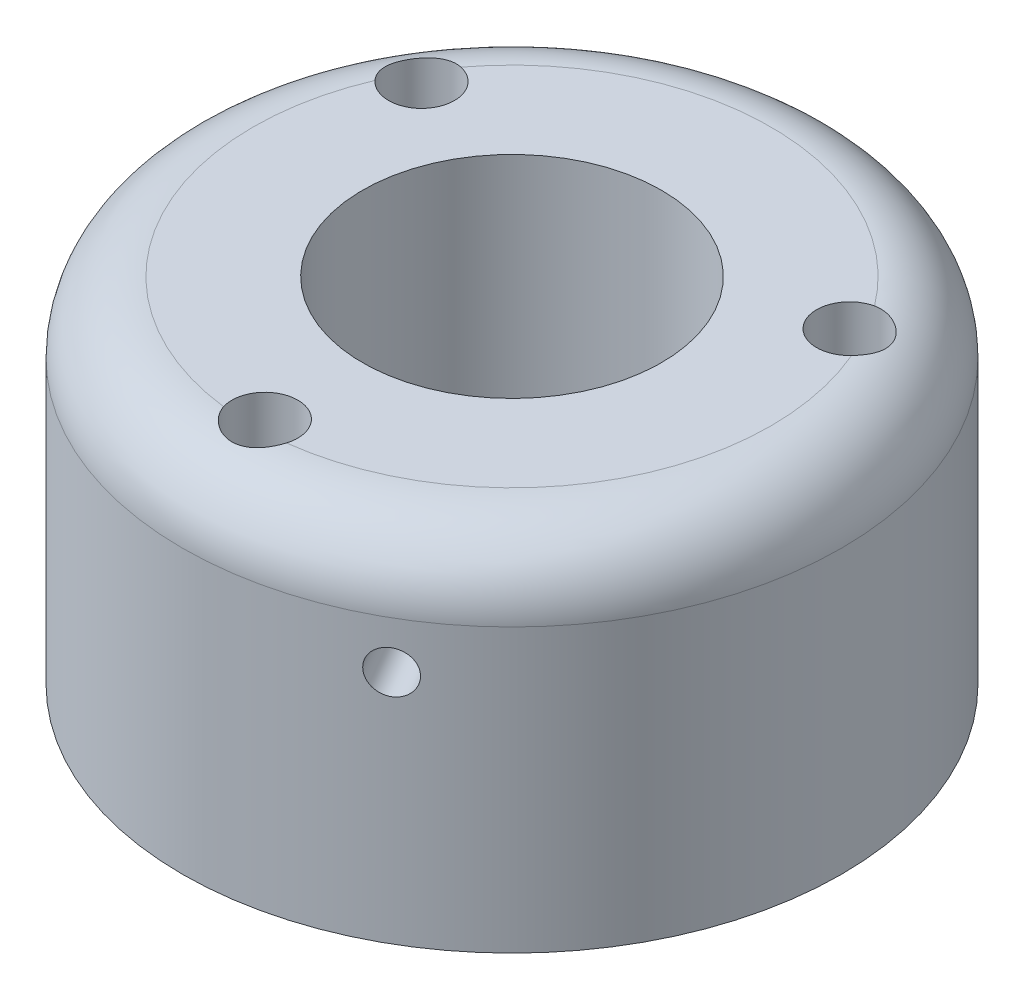
from build123d import *

# Parameters (mm, degrees)
SKETCH1_R               = 14
BOSS_EXTRUDE1_DEPTH     = 15
SKETCH2_R               = 1.4
SKETCH2_R_2             = 6.35
CUT_EXTRUDE1_DEPTH      = 25.839484697
BOSS_EXTRUDE2_DEPTH     = 2
CUT_EXTRUDE2_DEPTH      = 17
CUT_EXTRUDE2_DEPTH_BACK = 10
SKETCH4_R               = 0.9
SKETCH4_W               = 10.5
SKETCH4_H               = 2
SKETCH5_R               = 2.8
CUT_EXTRUDE3_DEPTH      = 5
FILLET1_R               = 3


with BuildPart() as part:
    # Sketch1 → Boss-Extrude1 (new body)
    with BuildSketch(Plane(origin=(0, 0, 0), x_dir=(1, 0, 0), z_dir=(0, 1, 0))):
        with Locations(Location((0, 0, 0), (0, 0, 270))):
            Circle(SKETCH1_R)
    extrude(amount=BOSS_EXTRUDE1_DEPTH)

    # Sketch2 → Cut-Extrude1 (cut, through all)
    with BuildSketch(Plane.XZ):
        with Locations(Location((0, 10.5, 0), (0, 0, 270))):
            Circle(SKETCH2_R)
        with Locations(Location((0, 0, 0), (0, 0, 270))):
            Circle(SKETCH2_R_2)
        with Locations(Location((9.09326674, -5.25, 0), (0, 0, 270))):
            Circle(SKETCH2_R)
        with Locations(Location((-9.09326674, -5.25, 0), (0, 0, 270))):
            Circle(SKETCH2_R)
    extrude(amount=-CUT_EXTRUDE1_DEPTH, mode=Mode.SUBTRACT)

    # Sketch3 → Boss-Extrude2 (add)
    with BuildSketch(Plane(origin=(0, 0, 0), x_dir=(1, 0, 0), z_dir=(0, 1, 0))):
        Polygon((0, 0), (9.09326674, -5.25), (0, -10.5), align=None)
    extrude(amount=-BOSS_EXTRUDE2_DEPTH)

    # Sketch4 → Cut-Extrude2 (cut, two sides: drawn at the far end of the back side and taken through both)
    with BuildSketch(Plane(origin=(4.54663337, 0, 7.875), x_dir=(0.8660254037844364, 0, -0.5000000000000041), z_dir=(0.500000000000004, 0, 0.8660254037844363)).offset(-CUT_EXTRUDE2_DEPTH_BACK)):
        with Locations(Location((0, 10, 0), (0, 0, 180))):
            Circle(SKETCH4_R)
        with Locations((0, -1)):
            Rectangle(SKETCH4_W, SKETCH4_H)
    extrude(amount=CUT_EXTRUDE2_DEPTH + CUT_EXTRUDE2_DEPTH_BACK, mode=Mode.SUBTRACT)

    # Sketch5 → Cut-Extrude3 (cut)
    with BuildSketch(Plane.XZ):
        with Locations(Location((9.09326674, 5.25, 0), (0, 0, 270))):
            Circle(SKETCH5_R)
        with Locations(Location((0, -10.5, 0), (0, 0, 270))):
            Circle(SKETCH5_R)
        with Locations(Location((-9.09326674, 5.25, 0), (0, 0, 270))):
            Circle(SKETCH5_R)
    extrude(amount=-CUT_EXTRUDE3_DEPTH, mode=Mode.SUBTRACT)

    # Fillet1
    # the kernel refuses this fillet: 3 mm, written as the material it takes off along each edge
    with BuildSketch(Plane(origin=(0, 15, 0), x_dir=(0, 0, 1), z_dir=(-1, 0, 0))) as fillet1_piece_1:
        with BuildLine():
            CenterArc((14 - FILLET1_R, -FILLET1_R), FILLET1_R, 0, 90)
            Line((14 - FILLET1_R, 0), (14, 0))
            Line((14, 0), (14, -FILLET1_R))
        make_face()
    revolve(axis=Axis((0, 15, 0), (0, 1, 0)), mode=Mode.SUBTRACT)


solid = part.part
